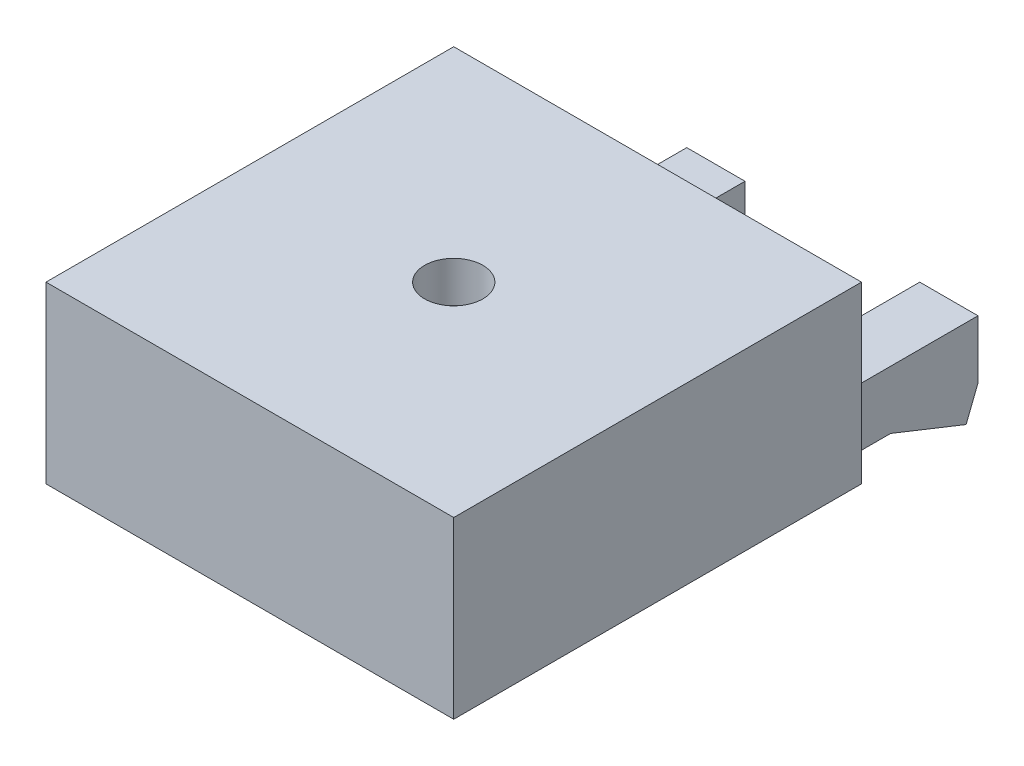
from build123d import *

# Parameters (mm, degrees)
ESQUISSE1_W             = 70
ESQUISSE1_H             = 70
BOSS_EXTRU_4_DEPTH      = 30
ESQUISSE5_W             = 60
ESQUISSE5_H             = 60
ENL_V_MAT_EXTRU_3_DEPTH = 23
ESQUISSE6_R             = 5
ENL_V_MAT_EXTRU_4_DEPTH = 23
ESQUISSE28_W            = 10
ESQUISSE28_H            = 30
BOSS_EXTRU_8_DEPTH      = 5
BOSS_EXTRU_9_DEPTH      = 10
ESQUISSE30_W            = 10
ESQUISSE30_H            = 30
BOSS_EXTRU_10_DEPTH     = 5
BOSS_EXTRU_14_DEPTH     = 10
ENL_V_MAT_EXTRU_6_DEPTH = 10


with BuildPart() as part:
    # Esquisse1 → Boss.-Extru.4 (new body)
    with BuildSketch(Plane(origin=(0, 0, 0), x_dir=(1, 0, 0), z_dir=(0, 1, 0))):
        with Locations((35, 35)):
            Rectangle(ESQUISSE1_W, ESQUISSE1_H)
    extrude(amount=BOSS_EXTRU_4_DEPTH)

    # Esquisse5 → Enlèv. mat.-Extru.3 (cut)
    with BuildSketch(Plane(origin=(0, 0, 0), x_dir=(-1, 0, 0), z_dir=(0, -1, 0))):
        with Locations((-35, 35)):
            Rectangle(ESQUISSE5_W, ESQUISSE5_H)
    extrude(amount=-ENL_V_MAT_EXTRU_3_DEPTH, mode=Mode.SUBTRACT)

    # Esquisse6 → Enlèv. mat.-Extru.4 (cut)
    with BuildSketch(Plane(origin=(0, 23, 0), x_dir=(-1, 0, 0), z_dir=(0, -1, 0))):
        with Locations((-35, 35)):
            Circle(ESQUISSE6_R)
    extrude(amount=-ENL_V_MAT_EXTRU_4_DEPTH, mode=Mode.SUBTRACT)

    # Esquisse28 → Boss.-Extru.8 (add, symmetric)
    with BuildSketch(Plane.XZ):
        with Locations((55.004966989, -85)):
            Rectangle(ESQUISSE28_W, ESQUISSE28_H)
    extrude(amount=BOSS_EXTRU_8_DEPTH, both=True)

    # Esquisse29 → Boss.-Extru.9 (add)
    with BuildSketch(Plane(origin=(60.004966989, 0, 0), x_dir=(0, 0, -1), z_dir=(1, 0, 0))):
        Polygon((98.641624501, -8.437704854), (100, -5), (85, -5), (97.962436751, -10.156557281), align=None)
    extrude(amount=-BOSS_EXTRU_9_DEPTH)

    # Esquisse30 → Boss.-Extru.10 (add, symmetric)
    with BuildSketch(Plane.XZ):
        with Locations((15.004966989, -85)):
            Rectangle(ESQUISSE30_W, ESQUISSE30_H)
    extrude(amount=BOSS_EXTRU_10_DEPTH, both=True)

    # Esquisse39 → Boss.-Extru.14 (add)
    with BuildSketch(Plane.ZY.offset(-10.004966989)):
        Polygon((-100, -5), (-95.960946885, -15.231620103), (-85, -5), align=None)
    extrude(amount=-BOSS_EXTRU_14_DEPTH)

    # Esquisse40 → Enlèv. mat.-Extru.6 (cut)
    with BuildSketch(Plane(origin=(0, -34.827896321, -88.22508495), x_dir=(-1, 0, 0), z_dir=(0, -0.3671866467775486, -0.930147282116257))):
        Polygon((-20.004966989, 21.067928267), (-20.004966989, 22.067928267), (-10.004966989, 21.067928267), align=None)
    extrude(amount=-ENL_V_MAT_EXTRU_6_DEPTH, mode=Mode.SUBTRACT)


solid = part.part
